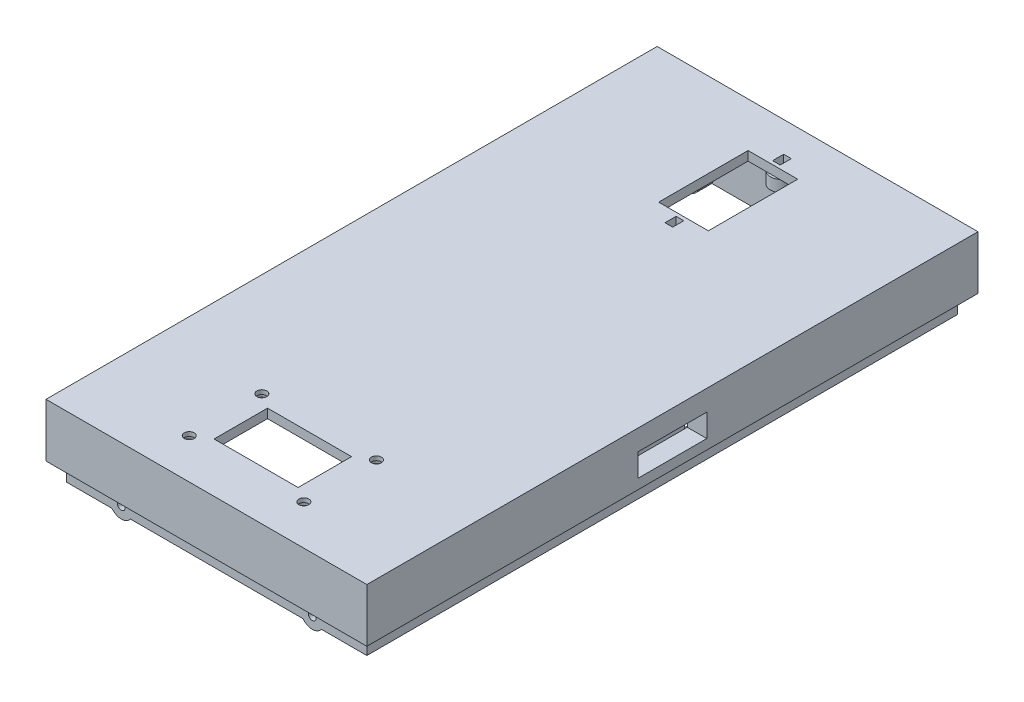
from build123d import *

# Parameters (mm, degrees)
BOSS_EXTRUDE1_START  = -80
SKETCH1_W            = 84
SKETCH1_H            = 14
BOSS_EXTRUDE1_DEPTH  = 160
BOSS_EXTRUDE2_START  = -77.3
SKETCH2_W            = 78.6
SKETCH2_H            = 5.3
BOSS_EXTRUDE2_DEPTH  = 154.6
BOSS_EXTRUDE3_START  = -74.9
SKETCH3_W            = 73.8
SKETCH3_H            = 17.4
BOSS_EXTRUDE3_DEPTH  = 149.8
BOSS_EXTRUDE4_START  = -77.3
SKETCH4_R            = 3
BOSS_EXTRUDE4_DEPTH  = 6.3
BOSS_EXTRUDE5_START  = -78
SKETCH5_R            = 1
BOSS_EXTRUDE5_DEPTH  = 8
BOSS_EXTRUDE6_START  = -77.3
SKETCH6_R            = 3
BOSS_EXTRUDE6_DEPTH  = 6.3
BOSS_EXTRUDE7_START  = -78
SKETCH7_R            = 1
BOSS_EXTRUDE7_DEPTH  = 8
BOSS_EXTRUDE8_START  = 71
SKETCH8_R            = 3
BOSS_EXTRUDE8_DEPTH  = 6.3
BOSS_EXTRUDE9_START  = 70
SKETCH9_R            = 1
BOSS_EXTRUDE9_DEPTH  = 8
BOSS_EXTRUDE10_START = 71
SKETCH10_R           = 3
BOSS_EXTRUDE10_DEPTH = 6.3
BOSS_EXTRUDE11_START = 70
SKETCH11_R           = 1
BOSS_EXTRUDE11_DEPTH = 8
BOSS_EXTRUDE12_START = 53
SKETCH12_W           = 22
SKETCH12_H           = 4.4
BOSS_EXTRUDE12_DEPTH = 14
BOSS_EXTRUDE13_START = 46.6
SKETCH13_R           = 1.3
BOSS_EXTRUDE13_DEPTH = 4.4
BOSS_EXTRUDE14_START = 47.1
SKETCH14_R           = 2.3
BOSS_EXTRUDE14_DEPTH = 1.8
BOSS_EXTRUDE15_START = 46.6
SKETCH15_R           = 1.3
BOSS_EXTRUDE15_DEPTH = 4.4
BOSS_EXTRUDE16_START = 47.1
SKETCH16_R           = 2.3
BOSS_EXTRUDE16_DEPTH = 1.8
BOSS_EXTRUDE17_START = 46.6
SKETCH17_R           = 1.3
BOSS_EXTRUDE17_DEPTH = 4.4
BOSS_EXTRUDE18_START = 47.1
SKETCH18_R           = 2.3
BOSS_EXTRUDE18_DEPTH = 1.8
BOSS_EXTRUDE19_START = 46.6
SKETCH19_R           = 1.3
BOSS_EXTRUDE19_DEPTH = 4.4
BOSS_EXTRUDE20_START = 47.1
SKETCH20_R           = 2.3
BOSS_EXTRUDE20_DEPTH = 1.8
BOSS_EXTRUDE21_START = -68.3
SKETCH21_W           = 13
SKETCH21_H           = 4.4
BOSS_EXTRUDE21_DEPTH = 23.4
BOSS_EXTRUDE22_START = 44.6
SKETCH22_R           = 3
BOSS_EXTRUDE22_DEPTH = 3
BOSS_EXTRUDE23_START = -72.125
SKETCH23_W           = 2
SKETCH23_H           = 7.4
BOSS_EXTRUDE23_DEPTH = 2.9
BOSS_EXTRUDE24_START = 44.6
SKETCH24_R           = 3
BOSS_EXTRUDE24_DEPTH = 3
BOSS_EXTRUDE25_START = -43.975
SKETCH25_W           = 2
SKETCH25_H           = 7.4
BOSS_EXTRUDE25_DEPTH = 2.9
BOSS_EXTRUDE26_START = -9
SKETCH26_W           = 7
SKETCH26_H           = 6
BOSS_EXTRUDE26_DEPTH = 18
BOSS_EXTRUDE27_START = -13.5
SKETCH27_W           = 3.3
SKETCH27_H           = 1.2
BOSS_EXTRUDE27_DEPTH = 27
BOSS_EXTRUDE28_START = -11
SKETCH28_W           = 1.2
SKETCH28_H           = 3.6
BOSS_EXTRUDE28_DEPTH = 22
BOSS_EXTRUDE29_START = -9
SKETCH29_W           = 7
SKETCH29_H           = 6
BOSS_EXTRUDE29_DEPTH = 18
BOSS_EXTRUDE30_START = -13.5
SKETCH30_W           = 3.3
SKETCH30_H           = 1.2
BOSS_EXTRUDE30_DEPTH = 27
BOSS_EXTRUDE31_START = -11
SKETCH31_W           = 1.2
SKETCH31_H           = 3.6
BOSS_EXTRUDE31_DEPTH = 22
BOSS_EXTRUDE32_START = 3.6
SKETCH32_W           = 1.2
SKETCH32_H           = 2.5
BOSS_EXTRUDE32_DEPTH = 22.4
BOSS_EXTRUDE33_START = 3.6
SKETCH33_W           = 1.2
SKETCH33_H           = 2.5
BOSS_EXTRUDE33_DEPTH = 22.4
BOSS_EXTRUDE34_START = 2.4
SKETCH34_W           = 19.6
SKETCH34_H           = 2.5
BOSS_EXTRUDE34_DEPTH = 1.2
BOSS_EXTRUDE35_START = 26
SKETCH35_W           = 19.6
SKETCH35_H           = 2.5
BOSS_EXTRUDE35_DEPTH = 1.2
BOSS_EXTRUDE36_START = 16.5
SKETCH36_W           = 1.2
SKETCH36_H           = 2.5
BOSS_EXTRUDE36_DEPTH = 30.5
BOSS_EXTRUDE37_START = 15.3
SKETCH37_W           = 22
SKETCH37_H           = 2.5
BOSS_EXTRUDE37_DEPTH = 1.2
BOSS_EXTRUDE38_START = -37.5
SKETCH38_W           = 1.2
SKETCH38_H           = 2.5
BOSS_EXTRUDE38_DEPTH = 36
BOSS_EXTRUDE39_START = -37.5
SKETCH39_W           = 1.2
SKETCH39_H           = 2.5
BOSS_EXTRUDE39_DEPTH = 36
BOSS_EXTRUDE40_START = -38.7
SKETCH40_W           = 52.8
SKETCH40_H           = 2.5
BOSS_EXTRUDE40_DEPTH = 1.2
BOSS_EXTRUDE41_START = -1.5
SKETCH41_W           = 52.8
SKETCH41_H           = 2.5
BOSS_EXTRUDE41_DEPTH = 1.2


with BuildPart() as part:
    # Sketch1 → Boss-Extrude1 (new body)
    with BuildSketch(Plane.XY.offset(BOSS_EXTRUDE1_START)):
        with Locations((0, 43)):
            Rectangle(SKETCH1_W, SKETCH1_H)
    extrude(amount=BOSS_EXTRUDE1_DEPTH)

    # Sketch2 → Boss-Extrude2 (add)
    with BuildSketch(Plane.XY.offset(BOSS_EXTRUDE2_START)):
        with Locations((0, 33.85)):
            Rectangle(SKETCH2_W, SKETCH2_H)
    extrude(amount=BOSS_EXTRUDE2_DEPTH)


with BuildPart() as body_2:
    # Sketch3 → Boss-Extrude3 (new body)
    with BuildSketch(Plane.XY.offset(BOSS_EXTRUDE3_START)):
        with Locations((0, 38.9)):
            Rectangle(SKETCH3_W, SKETCH3_H)
    extrude(amount=BOSS_EXTRUDE3_DEPTH)


with BuildPart() as part_1:
    add(part.part)

    # Combine1: cut body 2
    add(body_2.part, mode=Mode.SUBTRACT)

    # Sketch4 → Boss-Extrude4 (add)
    with BuildSketch(Plane.XY.offset(BOSS_EXTRUDE4_START)):
        with Locations((-25, 33)):
            Circle(SKETCH4_R)
    extrude(amount=BOSS_EXTRUDE4_DEPTH)


with BuildPart() as body_2_2:
    # Sketch5 → Boss-Extrude5 (new body)
    with BuildSketch(Plane.XY.offset(BOSS_EXTRUDE5_START)):
        with Locations((-25, 33)):
            Circle(SKETCH5_R)
    extrude(amount=BOSS_EXTRUDE5_DEPTH)


with BuildPart() as part_2:
    add(part_1.part)

    # Combine2: cut body 2 2
    add(body_2_2.part, mode=Mode.SUBTRACT)

    # Sketch6 → Boss-Extrude6 (add)
    with BuildSketch(Plane.XY.offset(BOSS_EXTRUDE6_START)):
        with Locations((25, 33)):
            Circle(SKETCH6_R)
    extrude(amount=BOSS_EXTRUDE6_DEPTH)


with BuildPart() as body_2_3:
    # Sketch7 → Boss-Extrude7 (new body)
    with BuildSketch(Plane.XY.offset(BOSS_EXTRUDE7_START)):
        with Locations((25, 33)):
            Circle(SKETCH7_R)
    extrude(amount=BOSS_EXTRUDE7_DEPTH)


with BuildPart() as part_3:
    add(part_2.part)

    # Combine3: cut body 2 3
    add(body_2_3.part, mode=Mode.SUBTRACT)

    # Sketch8 → Boss-Extrude8 (add)
    with BuildSketch(Plane.XY.offset(BOSS_EXTRUDE8_START)):
        with Locations((-25, 33)):
            Circle(SKETCH8_R)
    extrude(amount=BOSS_EXTRUDE8_DEPTH)


with BuildPart() as body_2_4:
    # Sketch9 → Boss-Extrude9 (new body)
    with BuildSketch(Plane.XY.offset(BOSS_EXTRUDE9_START)):
        with Locations((-25, 33)):
            Circle(SKETCH9_R)
    extrude(amount=BOSS_EXTRUDE9_DEPTH)


with BuildPart() as part_4:
    add(part_3.part)

    # Combine4: cut body 2 4
    add(body_2_4.part, mode=Mode.SUBTRACT)

    # Sketch10 → Boss-Extrude10 (add)
    with BuildSketch(Plane.XY.offset(BOSS_EXTRUDE10_START)):
        with Locations((25, 33)):
            Circle(SKETCH10_R)
    extrude(amount=BOSS_EXTRUDE10_DEPTH)


with BuildPart() as body_2_5:
    # Sketch11 → Boss-Extrude11 (new body)
    with BuildSketch(Plane.XY.offset(BOSS_EXTRUDE11_START)):
        with Locations((25, 33)):
            Circle(SKETCH11_R)
    extrude(amount=BOSS_EXTRUDE11_DEPTH)


with BuildPart() as part_5:
    add(part_4.part)

    # Combine5: cut body 2 5
    add(body_2_5.part, mode=Mode.SUBTRACT)


with BuildPart() as body_2_6:
    # Sketch12 → Boss-Extrude12 (new body)
    with BuildSketch(Plane.XY.offset(BOSS_EXTRUDE12_START)):
        with Locations((0, 48.8)):
            Rectangle(SKETCH12_W, SKETCH12_H)
    extrude(amount=BOSS_EXTRUDE12_DEPTH)


with BuildPart() as part_6:
    add(part_5.part)

    # Combine6: cut body 2 6
    add(body_2_6.part, mode=Mode.SUBTRACT)


with BuildPart() as body_2_7:
    # Sketch13 → Boss-Extrude13 (new body)
    with BuildSketch(Plane(origin=(0, 0, 0), x_dir=(1, 0, 0), z_dir=(0, 1, 0)).offset(BOSS_EXTRUDE13_START)):
        with Locations((-15, -50.5)):
            Circle(SKETCH13_R)
    extrude(amount=BOSS_EXTRUDE13_DEPTH)


with BuildPart() as part_7:
    add(part_6.part)

    # Combine7: cut body 2 7
    add(body_2_7.part, mode=Mode.SUBTRACT)


with BuildPart() as body_2_8:
    # Sketch14 → Boss-Extrude14 (new body)
    with BuildSketch(Plane(origin=(0, 0, 0), x_dir=(1, 0, 0), z_dir=(0, 1, 0)).offset(BOSS_EXTRUDE14_START)):
        with Locations((-15, -50.5)):
            Circle(SKETCH14_R)
    extrude(amount=BOSS_EXTRUDE14_DEPTH)


with BuildPart() as part_8:
    add(part_7.part)

    # Combine8: cut body 2 8
    add(body_2_8.part, mode=Mode.SUBTRACT)


with BuildPart() as body_2_9:
    # Sketch15 → Boss-Extrude15 (new body)
    with BuildSketch(Plane(origin=(0, 0, 0), x_dir=(1, 0, 0), z_dir=(0, 1, 0)).offset(BOSS_EXTRUDE15_START)):
        with Locations((-15, -69.5)):
            Circle(SKETCH15_R)
    extrude(amount=BOSS_EXTRUDE15_DEPTH)


with BuildPart() as part_9:
    add(part_8.part)

    # Combine9: cut body 2 9
    add(body_2_9.part, mode=Mode.SUBTRACT)


with BuildPart() as body_2_10:
    # Sketch16 → Boss-Extrude16 (new body)
    with BuildSketch(Plane(origin=(0, 0, 0), x_dir=(1, 0, 0), z_dir=(0, 1, 0)).offset(BOSS_EXTRUDE16_START)):
        with Locations((-15, -69.5)):
            Circle(SKETCH16_R)
    extrude(amount=BOSS_EXTRUDE16_DEPTH)


with BuildPart() as part_10:
    add(part_9.part)

    # Combine10: cut body 2 10
    add(body_2_10.part, mode=Mode.SUBTRACT)


with BuildPart() as body_2_11:
    # Sketch17 → Boss-Extrude17 (new body)
    with BuildSketch(Plane(origin=(0, 0, 0), x_dir=(1, 0, 0), z_dir=(0, 1, 0)).offset(BOSS_EXTRUDE17_START)):
        with Locations((15, -50.5)):
            Circle(SKETCH17_R)
    extrude(amount=BOSS_EXTRUDE17_DEPTH)


with BuildPart() as part_11:
    add(part_10.part)

    # Combine11: cut body 2 11
    add(body_2_11.part, mode=Mode.SUBTRACT)


with BuildPart() as body_2_12:
    # Sketch18 → Boss-Extrude18 (new body)
    with BuildSketch(Plane(origin=(0, 0, 0), x_dir=(1, 0, 0), z_dir=(0, 1, 0)).offset(BOSS_EXTRUDE18_START)):
        with Locations((15, -50.5)):
            Circle(SKETCH18_R)
    extrude(amount=BOSS_EXTRUDE18_DEPTH)


with BuildPart() as part_12:
    add(part_11.part)

    # Combine12: cut body 2 12
    add(body_2_12.part, mode=Mode.SUBTRACT)


with BuildPart() as body_2_13:
    # Sketch19 → Boss-Extrude19 (new body)
    with BuildSketch(Plane(origin=(0, 0, 0), x_dir=(1, 0, 0), z_dir=(0, 1, 0)).offset(BOSS_EXTRUDE19_START)):
        with Locations((15, -69.5)):
            Circle(SKETCH19_R)
    extrude(amount=BOSS_EXTRUDE19_DEPTH)


with BuildPart() as part_13:
    add(part_12.part)

    # Combine13: cut body 2 13
    add(body_2_13.part, mode=Mode.SUBTRACT)


with BuildPart() as body_2_14:
    # Sketch20 → Boss-Extrude20 (new body)
    with BuildSketch(Plane(origin=(0, 0, 0), x_dir=(1, 0, 0), z_dir=(0, 1, 0)).offset(BOSS_EXTRUDE20_START)):
        with Locations((15, -69.5)):
            Circle(SKETCH20_R)
    extrude(amount=BOSS_EXTRUDE20_DEPTH)


with BuildPart() as part_14:
    add(part_13.part)

    # Combine14: cut body 2 14
    add(body_2_14.part, mode=Mode.SUBTRACT)


with BuildPart() as body_2_15:
    # Sketch21 → Boss-Extrude21 (new body)
    with BuildSketch(Plane.XY.offset(BOSS_EXTRUDE21_START)):
        with Locations((0, 48.8)):
            Rectangle(SKETCH21_W, SKETCH21_H)
    extrude(amount=BOSS_EXTRUDE21_DEPTH)


with BuildPart() as part_15:
    add(part_14.part)

    # Combine15: cut body 2 15
    add(body_2_15.part, mode=Mode.SUBTRACT)

    # Sketch22 → Boss-Extrude22 (add)
    with BuildSketch(Plane(origin=(0, 0, 0), x_dir=(1, 0, 0), z_dir=(0, 1, 0)).offset(BOSS_EXTRUDE22_START)):
        with Locations((0, 70.675)):
            Circle(SKETCH22_R)
    extrude(amount=BOSS_EXTRUDE22_DEPTH)


with BuildPart() as body_2_16:
    # Sketch23 → Boss-Extrude23 (new body)
    with BuildSketch(Plane.XY.offset(BOSS_EXTRUDE23_START)):
        with Locations((0, 47.3)):
            Rectangle(SKETCH23_W, SKETCH23_H)
    extrude(amount=BOSS_EXTRUDE23_DEPTH)


with BuildPart() as part_16:
    add(part_15.part)

    # Combine16: cut body 2 16
    add(body_2_16.part, mode=Mode.SUBTRACT)

    # Sketch24 → Boss-Extrude24 (add)
    with BuildSketch(Plane(origin=(0, 0, 0), x_dir=(1, 0, 0), z_dir=(0, 1, 0)).offset(BOSS_EXTRUDE24_START)):
        with Locations((0, 42.525)):
            Circle(SKETCH24_R)
    extrude(amount=BOSS_EXTRUDE24_DEPTH)


with BuildPart() as body_2_17:
    # Sketch25 → Boss-Extrude25 (new body)
    with BuildSketch(Plane.XY.offset(BOSS_EXTRUDE25_START)):
        with Locations((0, 47.3)):
            Rectangle(SKETCH25_W, SKETCH25_H)
    extrude(amount=BOSS_EXTRUDE25_DEPTH)


with BuildPart() as part_17:
    add(part_16.part)

    # Combine17: cut body 2 17
    add(body_2_17.part, mode=Mode.SUBTRACT)


with BuildPart() as body_2_18:
    # Sketch26 → Boss-Extrude26 (new body)
    with BuildSketch(Plane.XY.offset(BOSS_EXTRUDE26_START)):
        with Locations((-39.5, 41.6)):
            Rectangle(SKETCH26_W, SKETCH26_H)
    extrude(amount=BOSS_EXTRUDE26_DEPTH)


with BuildPart() as part_18:
    add(part_17.part)

    # Combine18: cut body 2 18
    add(body_2_18.part, mode=Mode.SUBTRACT)

    # Sketch27 → Boss-Extrude27 (add)
    with BuildSketch(Plane.XY.offset(BOSS_EXTRUDE27_START)):
        with Locations((-35.25, 35)):
            Rectangle(SKETCH27_W, SKETCH27_H)
    extrude(amount=BOSS_EXTRUDE27_DEPTH)

    # Sketch28 → Boss-Extrude28 (add)
    with BuildSketch(Plane.XY.offset(BOSS_EXTRUDE28_START)):
        with Locations((-33.6, 36.2)):
            Rectangle(SKETCH28_W, SKETCH28_H)
    extrude(amount=BOSS_EXTRUDE28_DEPTH)


with BuildPart() as body_2_19:
    # Sketch29 → Boss-Extrude29 (new body)
    with BuildSketch(Plane.XY.offset(BOSS_EXTRUDE29_START)):
        with Locations((39.5, 41.6)):
            Rectangle(SKETCH29_W, SKETCH29_H)
    extrude(amount=BOSS_EXTRUDE29_DEPTH)


with BuildPart() as part_19:
    add(part_18.part)

    # Combine19: cut body 2 19
    add(body_2_19.part, mode=Mode.SUBTRACT)

    # Sketch30 → Boss-Extrude30 (add)
    with BuildSketch(Plane.XY.offset(BOSS_EXTRUDE30_START)):
        with Locations((35.25, 35)):
            Rectangle(SKETCH30_W, SKETCH30_H)
    extrude(amount=BOSS_EXTRUDE30_DEPTH)

    # Sketch31 → Boss-Extrude31 (add)
    with BuildSketch(Plane.XY.offset(BOSS_EXTRUDE31_START)):
        with Locations((33.6, 36.2)):
            Rectangle(SKETCH31_W, SKETCH31_H)
    extrude(amount=BOSS_EXTRUDE31_DEPTH)

    # Sketch32 → Boss-Extrude32 (add)
    with BuildSketch(Plane.XY.offset(BOSS_EXTRUDE32_START)):
        with Locations((-9.2, 46.35)):
            Rectangle(SKETCH32_W, SKETCH32_H)
    extrude(amount=BOSS_EXTRUDE32_DEPTH)

    # Sketch33 → Boss-Extrude33 (add)
    with BuildSketch(Plane.XY.offset(BOSS_EXTRUDE33_START)):
        with Locations((9.2, 46.35)):
            Rectangle(SKETCH33_W, SKETCH33_H)
    extrude(amount=BOSS_EXTRUDE33_DEPTH)

    # Sketch34 → Boss-Extrude34 (add)
    with BuildSketch(Plane.XY.offset(BOSS_EXTRUDE34_START)):
        with Locations((0, 46.35)):
            Rectangle(SKETCH34_W, SKETCH34_H)
    extrude(amount=BOSS_EXTRUDE34_DEPTH)

    # Sketch35 → Boss-Extrude35 (add)
    with BuildSketch(Plane.XY.offset(BOSS_EXTRUDE35_START)):
        with Locations((0, 46.35)):
            Rectangle(SKETCH35_W, SKETCH35_H)
    extrude(amount=BOSS_EXTRUDE35_DEPTH)

    # Sketch36 → Boss-Extrude36 (add)
    with BuildSketch(Plane.XY.offset(BOSS_EXTRUDE36_START)):
        with Locations((15.5, 46.35)):
            Rectangle(SKETCH36_W, SKETCH36_H)
    extrude(amount=BOSS_EXTRUDE36_DEPTH)

    # Sketch37 → Boss-Extrude37 (add)
    with BuildSketch(Plane.XY.offset(BOSS_EXTRUDE37_START)):
        with Locations((25.9, 46.35)):
            Rectangle(SKETCH37_W, SKETCH37_H)
    extrude(amount=BOSS_EXTRUDE37_DEPTH)

    # Sketch38 → Boss-Extrude38 (add)
    with BuildSketch(Plane.XY.offset(BOSS_EXTRUDE38_START)):
        with Locations((-25.8, 46.35)):
            Rectangle(SKETCH38_W, SKETCH38_H)
    extrude(amount=BOSS_EXTRUDE38_DEPTH)

    # Sketch39 → Boss-Extrude39 (add)
    with BuildSketch(Plane.XY.offset(BOSS_EXTRUDE39_START)):
        with Locations((25.8, 46.35)):
            Rectangle(SKETCH39_W, SKETCH39_H)
    extrude(amount=BOSS_EXTRUDE39_DEPTH)

    # Sketch40 → Boss-Extrude40 (add)
    with BuildSketch(Plane.XY.offset(BOSS_EXTRUDE40_START)):
        with Locations((0, 46.35)):
            Rectangle(SKETCH40_W, SKETCH40_H)
    extrude(amount=BOSS_EXTRUDE40_DEPTH)

    # Sketch41 → Boss-Extrude41 (add)
    with BuildSketch(Plane.XY.offset(BOSS_EXTRUDE41_START)):
        with Locations((0, 46.35)):
            Rectangle(SKETCH41_W, SKETCH41_H)
    extrude(amount=BOSS_EXTRUDE41_DEPTH)


solid = part_19.part
